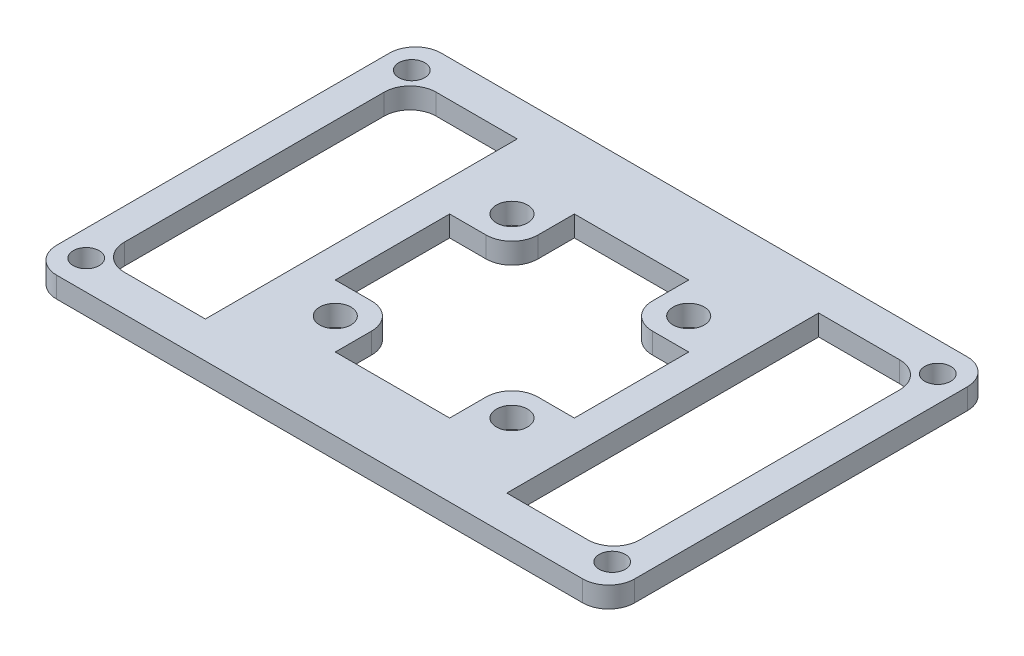
from build123d import *

# Parameters (mm, degrees)
SKETCH1_W           = 55.6
SKETCH1_H           = 37
BOSS_EXTRUDE1_DEPTH = 2
CUT_EXTRUDE2_REACH  = 35.453
FILLET2_R           = 2.5
CUT_EXTRUDE3_REACH  = 35.453
CUT_EXTRUDE4_REACH  = 35.453
SKETCH7_R           = 1.25
SKETCH3_R           = 1.5
CUT_EXTRUDE5_DEPTH  = 10


with BuildPart() as part:
    # Sketch1 → Boss-Extrude1 (new body)
    with BuildSketch(Plane(origin=(0, 0, 0), x_dir=(1, 0, 0), z_dir=(0, 1, 0))):
        Rectangle(SKETCH1_W, SKETCH1_H)
    extrude(amount=BOSS_EXTRUDE1_DEPTH)

    # Sketch5 → Cut-Extrude2 (cut, up to next)
    with BuildSketch(Plane(origin=(0, 2, 0), x_dir=(1, 0, 0), z_dir=(0, 1, 0)), mode=Mode.PRIVATE) as cut_extrude2_sk1:
        with BuildLine():
            Line((5.5, 11.5), (-5.5, 11.5))
            Line((-5.5, 11.5), (-5.5, 8))
            ThreePointArc((-5.5, 8), (-6.232233047, 6.232233047), (-8, 5.5))
            Line((-8, 5.5), (-11.5, 5.5))
            Line((-11.5, 5.5), (-11.5, -5.5))
            Line((-11.5, -5.5), (-8, -5.5))
            ThreePointArc((-8, -5.5), (-6.232233047, -6.232233047), (-5.5, -8))
            Line((-5.5, -8), (-5.5, -11.5))
            Line((-5.5, -11.5), (5.5, -11.5))
            Line((5.5, -11.5), (5.5, -8))
            ThreePointArc((5.5, -8), (6.232233047, -6.232233047), (8, -5.5))
            Line((8, -5.5), (11.5, -5.5))
            Line((11.5, -5.5), (11.5, 5.5))
            Line((11.5, 5.5), (8, 5.5))
            ThreePointArc((8, 5.5), (6.232233047, 6.232233047), (5.5, 8))
            Line((5.5, 8), (5.5, 11.5))
        make_face()
    cut_extrude2_tool1 = extrude(cut_extrude2_sk1.sketch, amount=-CUT_EXTRUDE2_REACH, mode=Mode.PRIVATE) & part.part
    add(cut_extrude2_tool1.solids().sort_by_distance((0, 2, 0))[0], mode=Mode.SUBTRACT)

    # Fillet2
    fillet2_edges = [part.edges().sort_by_distance(p)[0] for p in [
        (27.8, 1, -18.5),
        (-27.8, 1, -18.5),
        (27.8, 1, 18.5),
        (-27.8, 1, 18.5),
    ]]
    fillet(fillet2_edges, radius=FILLET2_R)

    # Sketch6 → Cut-Extrude3 (cut, up to next)
    with BuildSketch(Plane(origin=(0, 2, 0), x_dir=(1, 0, 0), z_dir=(0, 1, 0)), mode=Mode.PRIVATE) as cut_extrude3_sk1:
        with BuildLine():
            Line((-22.3, 15), (-14.5, 15))
            Line((-14.5, 15), (-14.5, -15))
            Line((-14.5, -15), (-22.3, -15))
            ThreePointArc((-22.3, -15), (-24.067766953, -14.267766953), (-24.8, -12.5))
            Line((-24.8, -12.5), (-24.8, 12.5))
            ThreePointArc((-24.8, 12.5), (-24.067766953, 14.267766953), (-22.3, 15))
        make_face()
    cut_extrude3_tool1 = extrude(cut_extrude3_sk1.sketch, amount=-CUT_EXTRUDE3_REACH, mode=Mode.PRIVATE) & part.part
    # Sketch6 → Cut-Extrude3 (cut, up to next)
    with BuildSketch(Plane(origin=(0, 2, 0), x_dir=(1, 0, 0), z_dir=(0, 1, 0)), mode=Mode.PRIVATE) as cut_extrude3_sk2:
        with BuildLine():
            Line((22.3, -15), (14.5, -15))
            Line((14.5, -15), (14.5, 15))
            Line((14.5, 15), (22.3, 15))
            ThreePointArc((22.3, 15), (24.067766953, 14.267766953), (24.8, 12.5))
            Line((24.8, 12.5), (24.8, -12.5))
            ThreePointArc((24.8, -12.5), (24.067766953, -14.267766953), (22.3, -15))
        make_face()
    cut_extrude3_tool2 = extrude(cut_extrude3_sk2.sketch, amount=-CUT_EXTRUDE3_REACH, mode=Mode.PRIVATE) & part.part
    add(cut_extrude3_tool1.solids().sort_by_distance((-19.60979, 2, 0))[0], mode=Mode.SUBTRACT)
    add(cut_extrude3_tool2.solids().sort_by_distance((19.60979, 2, 0))[0], mode=Mode.SUBTRACT)

    # Sketch7 → Cut-Extrude4 (cut, up to next)
    with BuildSketch(Plane(origin=(0, 2, 0), x_dir=(1, 0, 0), z_dir=(0, 1, 0)), mode=Mode.PRIVATE) as cut_extrude4_sk1:
        with Locations((-25.3, 15.66)):
            Circle(SKETCH7_R)
    cut_extrude4_tool1 = extrude(cut_extrude4_sk1.sketch, amount=-CUT_EXTRUDE4_REACH, mode=Mode.PRIVATE) & part.part
    # Sketch7 → Cut-Extrude4 (cut, up to next)
    with BuildSketch(Plane(origin=(0, 2, 0), x_dir=(1, 0, 0), z_dir=(0, 1, 0)), mode=Mode.PRIVATE) as cut_extrude4_sk2:
        with Locations((25.3, 15.66)):
            Circle(SKETCH7_R)
    cut_extrude4_tool2 = extrude(cut_extrude4_sk2.sketch, amount=-CUT_EXTRUDE4_REACH, mode=Mode.PRIVATE) & part.part
    # Sketch7 → Cut-Extrude4 (cut, up to next)
    with BuildSketch(Plane(origin=(0, 2, 0), x_dir=(1, 0, 0), z_dir=(0, 1, 0)), mode=Mode.PRIVATE) as cut_extrude4_sk3:
        with Locations((25.3, -15.66)):
            Circle(SKETCH7_R)
    cut_extrude4_tool3 = extrude(cut_extrude4_sk3.sketch, amount=-CUT_EXTRUDE4_REACH, mode=Mode.PRIVATE) & part.part
    # Sketch7 → Cut-Extrude4 (cut, up to next)
    with BuildSketch(Plane(origin=(0, 2, 0), x_dir=(1, 0, 0), z_dir=(0, 1, 0)), mode=Mode.PRIVATE) as cut_extrude4_sk4:
        with Locations((-25.3, -15.66)):
            Circle(SKETCH7_R)
    cut_extrude4_tool4 = extrude(cut_extrude4_sk4.sketch, amount=-CUT_EXTRUDE4_REACH, mode=Mode.PRIVATE) & part.part
    add(cut_extrude4_tool1.solids().sort_by_distance((-25.3, 2, -15.66))[0], mode=Mode.SUBTRACT)
    add(cut_extrude4_tool2.solids().sort_by_distance((25.3, 2, -15.66))[0], mode=Mode.SUBTRACT)
    add(cut_extrude4_tool3.solids().sort_by_distance((25.3, 2, 15.66))[0], mode=Mode.SUBTRACT)
    add(cut_extrude4_tool4.solids().sort_by_distance((-25.3, 2, 15.66))[0], mode=Mode.SUBTRACT)

    # Sketch3 → Cut-Extrude5 (cut)
    with BuildSketch(Plane(origin=(0, 2, 0), x_dir=(1, 0, 0), z_dir=(0, 1, 0))):
        with Locations((-8.5, 8.5)):
            Circle(SKETCH3_R)
        with Locations((8.5, 8.5)):
            Circle(SKETCH3_R)
        with Locations((-8.5, -8.5)):
            Circle(SKETCH3_R)
        with Locations((8.5, -8.5)):
            Circle(SKETCH3_R)
    extrude(amount=-CUT_EXTRUDE5_DEPTH, mode=Mode.SUBTRACT)


solid = part.part
